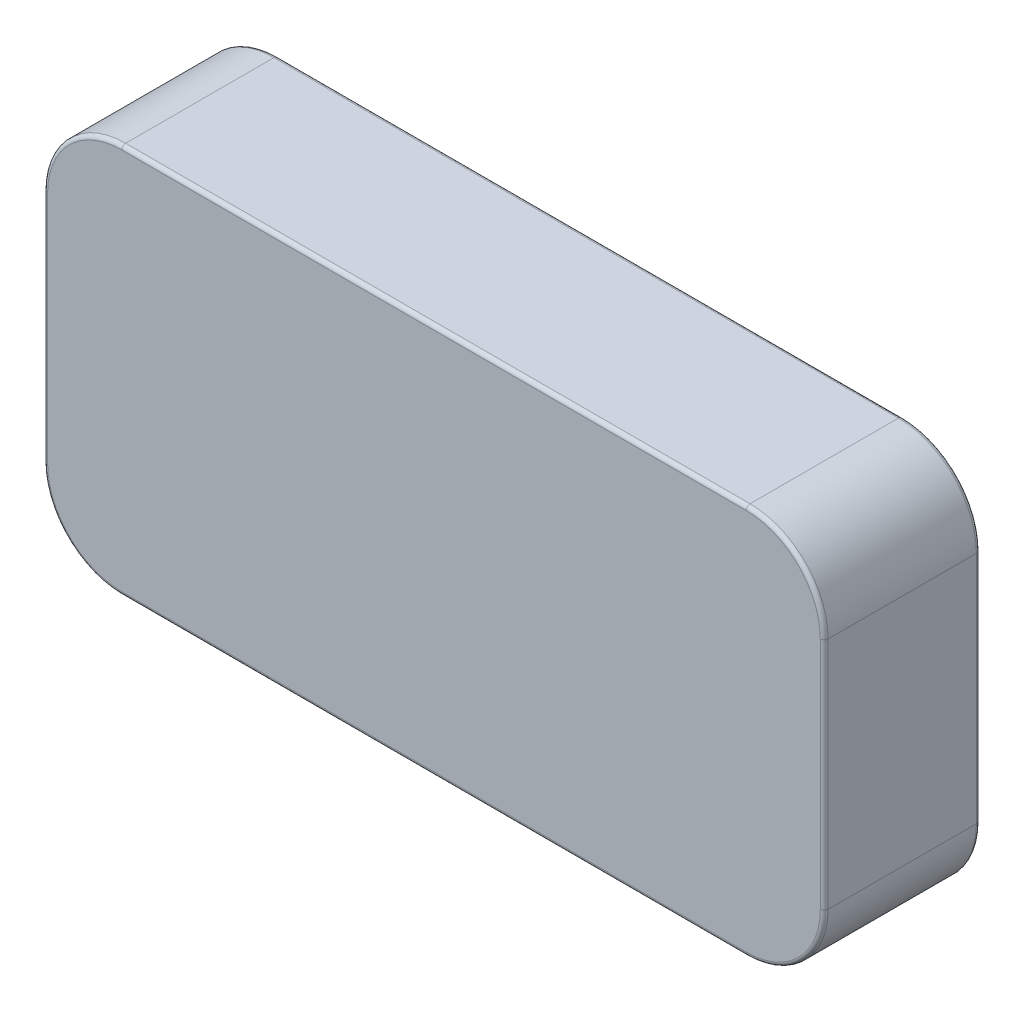
from build123d import *

# Parameters (mm, degrees)
SKETCH1_W           = 100
SKETCH1_H           = 50
BOSS_EXTRUDE1_DEPTH = 20
FILLET1_R           = 10
FILLET2_R           = 0.5


with BuildPart() as part:
    # Sketch1 → Boss-Extrude1 (new body)
    with BuildSketch(Plane.XY):
        Rectangle(SKETCH1_W, SKETCH1_H)
    extrude(amount=BOSS_EXTRUDE1_DEPTH)

    # Fillet1
    fillet1_edges = [part.edges().sort_by_distance(p)[0] for p in [
        (-50, -25, 10),
        (50, -25, 10),
        (50, 25, 10),
        (-50, 25, 10),
    ]]
    fillet(fillet1_edges, radius=FILLET1_R)

    # Fillet2
    fillet2_edges = [part.edges().sort_by_distance(p)[0] for p in [
        (47.071067812, 22.071067812, 0),
        (50, 0, 0),
        (47.071067812, -22.071067812, 0),
        (0, -25, 0),
        (-47.071067812, -22.071067812, 0),
        (-50, 0, 0),
        (-47.071067812, 22.071067812, 0),
        (47.071067812, 22.071067812, 20),
        (50, 0, 20),
        (47.071067812, -22.071067812, 20),
        (0, -25, 20),
        (-47.071067812, -22.071067812, 20),
        (-50, 0, 20),
        (-47.071067812, 22.071067812, 20),
        (0, 25, 0),
        (0, 25, 20),
    ]]
    fillet(fillet2_edges, radius=FILLET2_R)


solid = part.part
